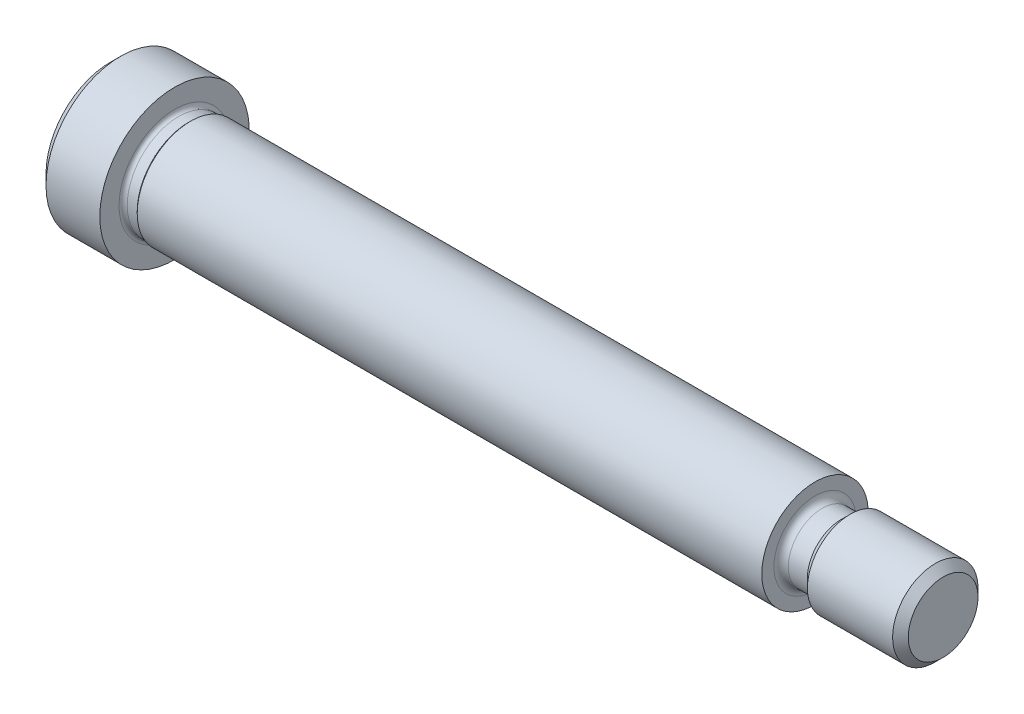
from build123d import *

# Parameters (mm, degrees)
HEX_2_DEPTH = 5.9436


# Read off the part's stored shape, not the designer's step: ThreadSchematic
with BuildPart() as part:
    # ThreadSchematic outline → ThreadSchematic (revolve)
    with BuildSketch(Plane.YX):
        with BuildLine():
            Line((0, 123.825), (0, 0))
            Line((0, 0), (9.5885, 0))
            Line((9.5885, 0), (11.1125, 1.524))
            Line((11.1125, 1.524), (11.1125, 9.525))
            Line((11.1125, 9.525), (8.255, 9.525))
            ThreePointArc((8.255, 9.525), (7.823947706, 9.703547706), (7.6454, 10.1346))
            Line((7.6454, 10.1346), (7.6454, 11.6205))
            Line((7.6454, 11.6205), (7.9121, 11.8872))
            Line((7.9121, 11.8872), (7.9121, 104.775))
            Line((7.9121, 104.775), (6.1087, 104.775))
            ThreePointArc((6.1087, 104.775), (5.354358486, 105.087458486), (5.0419, 105.8418))
            Line((5.0419, 105.8418), (5.0419, 108.6866))
            Line((5.0419, 108.6866), (6.35, 109.9947))
            Line((6.35, 109.9947), (6.35, 122.66168))
            Line((6.35, 122.66168), (5.18668, 123.825))
            Line((5.18668, 123.825), (0, 123.825))
        make_face()
    revolve(axis=Axis((0, 0, 0), (1, 0, 0)))

    # Sketch2 → PreBroach (revolve, cut)
    with BuildSketch(Plane.XY, mode=Mode.PRIVATE) as prebroach_sk:
        Polygon((0, 3.9624), (5.9436, 3.9624), (8.231292707, 0), (0, 0), align=None)
    revolve(prebroach_sk.sketch.rotate(Axis((0, 0, 0), (1, 0, 0)), 90), axis=Axis((0, 0, 0), (1, 0, 0)), mode=Mode.SUBTRACT)

    # Sketch3 → Hex 2 (cut)
    with BuildSketch(Plane.ZY):
        Polygon((-3.9624, -2.287692707), (-3.9624, 2.287692707), (0, 4.575385413), (3.9624, 2.287692707), (3.9624, -2.287692707), (0, -4.575385413), align=None)
    extrude(amount=-HEX_2_DEPTH, mode=Mode.SUBTRACT)


solid = part.part
